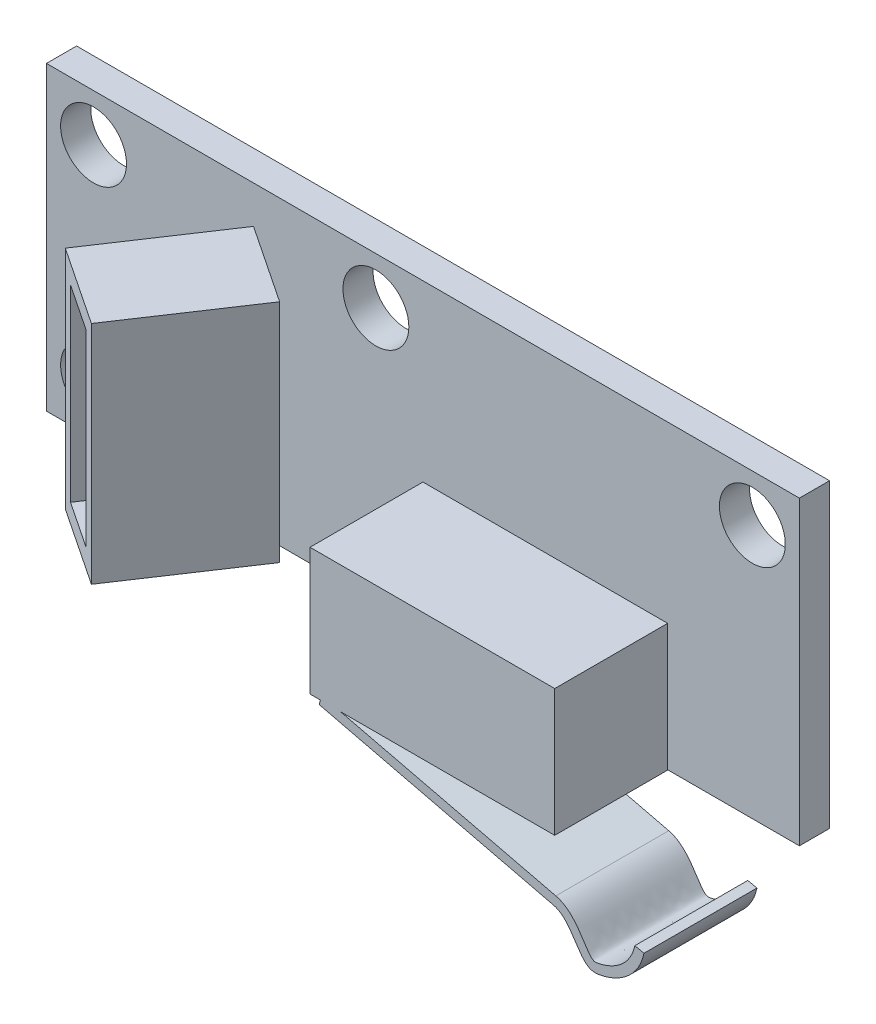
from build123d import *

# Parameters (mm, degrees)
SKETCH1_W           = 40
SKETCH1_H           = 16
SKETCH1_R           = 1.75
EXTRUDE1_DEPTH      = 1.6
SKETCH2_W           = 13
SKETCH2_H           = 6.754142386
EXTRUDE2_DEPTH      = 6
EXTRUDE_THIN1_START = -6
EXTRUDE_THIN1_DEPTH = 6
EXTRUDE3_DEPTH      = 6
EXTRUDE3_DEPTH_BACK = 6
SHELL1_T            = -1
EXTRUDE4_DEPTH      = 6
EXTRUDE4_DEPTH_BACK = 6


# Read off the part's stored shape, not the designer's step: Extrude-Thin1
with BuildPart() as part:
    # Sketch1 → Extrude1 (new body)
    with BuildSketch(Plane.XY):
        Rectangle(SKETCH1_W, SKETCH1_H)
        with Locations((-17.5, 5.5)):
            Circle(SKETCH1_R, mode=Mode.SUBTRACT)
        with Locations(Location((17.5, 5.5, 0), (0, 0, 180))):
            Circle(SKETCH1_R, mode=Mode.SUBTRACT)
        with Locations(Location((-17.5, -5.5, 0), (0, 0, 180))):
            Circle(SKETCH1_R, mode=Mode.SUBTRACT)
        with Locations((-2.5, 5.5)):
            Circle(SKETCH1_R, mode=Mode.SUBTRACT)
    extrude(amount=EXTRUDE1_DEPTH)

    # Sketch2 → Extrude2 (add)
    with BuildSketch(Plane.XY.offset(1.6)):
        with Locations((6.5, -4.638460583)):
            Rectangle(SKETCH2_W, SKETCH2_H)
    extrude(amount=EXTRUDE2_DEPTH)

    # Extrude-Thin1 outline → Extrude-Thin1 (add)
    with BuildSketch(Plane.XY.offset(7.6).offset(EXTRUDE_THIN1_START)):
        with BuildLine():
            Line((0.490840728, -8.25857598), (12.941437941, -11.25857598))
            add(Edge.make_bspline(
                [(12.941437941, -11.25857598), (13.067291507, -11.288900686), (13.181236211, -11.340967983), (13.397694142, -11.482359101), (13.49974484, -11.572007401), (13.790224047, -11.88131409), (13.96083617, -12.140688181), (14.20539816, -12.515236753), (14.285250733, -12.637639815), (14.451465801, -12.86408748), (14.537302747, -12.968584339), (14.688083246, -13.101089197), (14.742296743, -13.141233409), (14.862841146, -13.207776058), (14.930449466, -13.233266141), (15.127211291, -13.276318978), (15.250520499, -13.266569443), (15.418638539, -13.238985632), (15.471653276, -13.227738224), (15.58084969, -13.202236421), (15.636575352, -13.187706268), (15.806360125, -13.138466747), (15.923036621, -13.098113207), (16.276883006, -12.95177033), (16.518060705, -12.820511607), (16.971431108, -12.474902809), (17.183616041, -12.260202761), (17.532538565, -11.735362691), (17.66867522, -11.425299122), (17.744563111, -11.067386233)],
                knots=[0, 0, 0, 0, 0.0625, 0.0625, 0.125, 0.125, 0.25, 0.25, 0.3125, 0.3125, 0.375, 0.375, 0.40625, 0.40625, 0.4375, 0.4375, 0.5, 0.5, 0.53125, 0.53125, 0.5625, 0.5625, 0.625, 0.625, 0.75, 0.75, 0.875, 0.875, 1, 1, 1, 1], degree=3))
            Line((17.744563111, -11.067386233), (17.255436889, -10.963677318))
            add(Edge.make_bspline(
                [(13.058562059, -10.772487571), (13.245229843, -10.817465603), (13.41346766, -10.895444904), (13.712335202, -11.090666284), (13.843427458, -11.207583885), (14.196274895, -11.583301215), (14.379744249, -11.867711564), (14.62392859, -12.241681764), (14.699928814, -12.357591978), (14.842932135, -12.55241648), (14.910460781, -12.630878513), (14.996591837, -12.706569889), (15.022492719, -12.724784071), (15.065919556, -12.748756455), (15.082254893, -12.754653028), (15.144225267, -12.768212571), (15.202364037, -12.767785289), (15.321284852, -12.748273466), (15.366494295, -12.73884283), (15.458587584, -12.717335302), (15.505822811, -12.705023793), (15.650063368, -12.663192386), (15.74959397, -12.628770712), (16.050495881, -12.504324474), (16.253986383, -12.393105821), (16.629258319, -12.107032266), (16.801047526, -11.932527336), (17.082346492, -11.509404841), (17.192457189, -11.260710823), (17.255436889, -10.963677318)],
                knots=[0, 0, 0, 0, 0.0625, 0.0625, 0.125, 0.125, 0.25, 0.25, 0.3125, 0.3125, 0.375, 0.375, 0.40625, 0.40625, 0.4375, 0.4375, 0.5, 0.5, 0.53125, 0.53125, 0.5625, 0.5625, 0.625, 0.625, 0.75, 0.75, 0.875, 0.875, 1, 1, 1, 1], degree=3))
            Line((13.058562059, -10.772487571), (1.616646677, -8.015531776))
            Line((1.616646677, -8.015531776), (0.549402787, -8.015531776))
            Line((0.549402787, -8.015531776), (0.490840728, -8.25857598))
        make_face()
    extrude(amount=EXTRUDE_THIN1_DEPTH)

    # Sketch5 → Extrude4 (add, two sides: drawn at the far end of the back side and taken through both)
    with BuildSketch(Plane(origin=(0, 0, 0), x_dir=(1, 0, 0), z_dir=(0, 1, 0)).offset(-EXTRUDE4_DEPTH_BACK)):
        Polygon((-9.736964899, 0), (-9.458111879, 2), (-8.535084126, 2), (-8.263035101, 0), align=None)
    extrude(amount=EXTRUDE4_DEPTH + EXTRUDE4_DEPTH_BACK)


with BuildPart() as body_2:
    # Sketch4 → Extrude3 (new, two sides: drawn at the far end of the back side and taken through both)
    with BuildSketch(Plane(origin=(0, 0, 0), x_dir=(1, 0, 0), z_dir=(0, 1, 0)).offset(-EXTRUDE3_DEPTH_BACK)):
        Polygon((-13, -7.6), (-9, -1.6), (-4.839748528, -4.373500981), (-8.839748528, -10.373500981), align=None)
    extrude(amount=EXTRUDE3_DEPTH + EXTRUDE3_DEPTH_BACK)

    # Shell1
    shell1_openings = [body_2.faces().sort_by_distance(p)[0] for p in [
        (-10.919874264, 0, 8.986750491),
    ]]
    offset(amount=SHELL1_T, openings=shell1_openings, kind=Kind.INTERSECTION)


solid = Compound([part.part, body_2.part])
